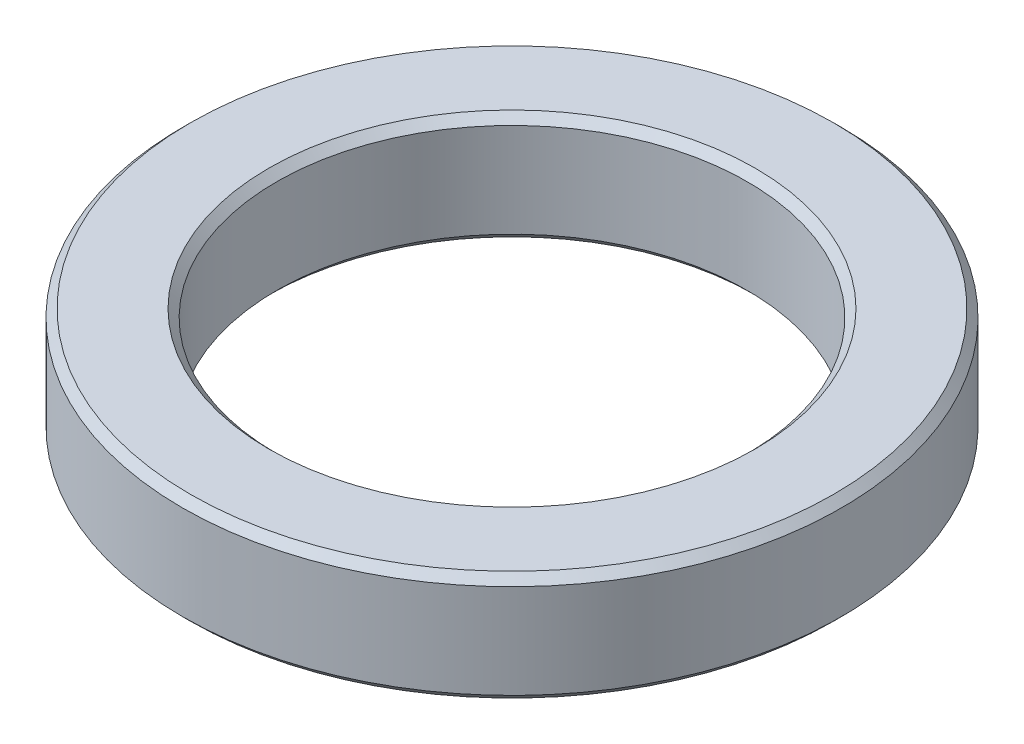
from build123d import *

# Parameters (mm, degrees)
SKETCH_1_R      = 21
SKETCH_1_R_2    = 15
EXTRUDE_1_DEPTH = 7
CHAMFER_1_SIZE  = 0.5


with BuildPart() as part:
    # 草图1 → 凸台-拉伸1 (new body)
    with BuildSketch(Plane(origin=(0, 0, 0), x_dir=(1, 0, 0), z_dir=(0, 1, 0))):
        Circle(SKETCH_1_R)
        Circle(SKETCH_1_R_2, mode=Mode.SUBTRACT)
    extrude(amount=EXTRUDE_1_DEPTH)

    # 倒角1
    chamfer_1_edges = [part.edges().sort_by_distance(p)[0] for p in [
        (-15, 0, 0),
        (-15, 7, 0),
        (-21, 0, 0),
        (-21, 7, 0),
    ]]
    chamfer(chamfer_1_edges, length=CHAMFER_1_SIZE)


solid = part.part
